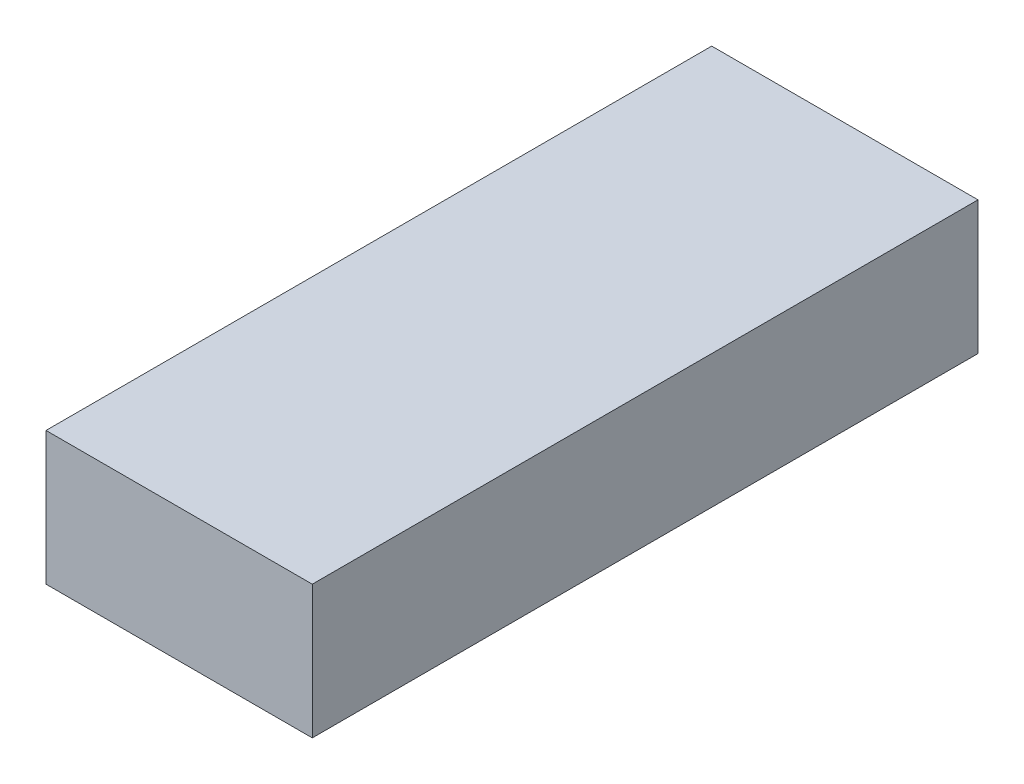
from build123d import *

# Parameters (mm, degrees)
SKETCH1_W           = 20
SKETCH1_H           = 50
BOSS_EXTRUDE1_DEPTH = 10


with BuildPart() as part:
    # Sketch1 → Boss-Extrude1 (new body)
    with BuildSketch(Plane(origin=(0, 0, 0), x_dir=(1, 0, 0), z_dir=(0, 1, 0))):
        with Locations((10, 25)):
            Rectangle(SKETCH1_W, SKETCH1_H)
    extrude(amount=BOSS_EXTRUDE1_DEPTH)


solid = part.part
